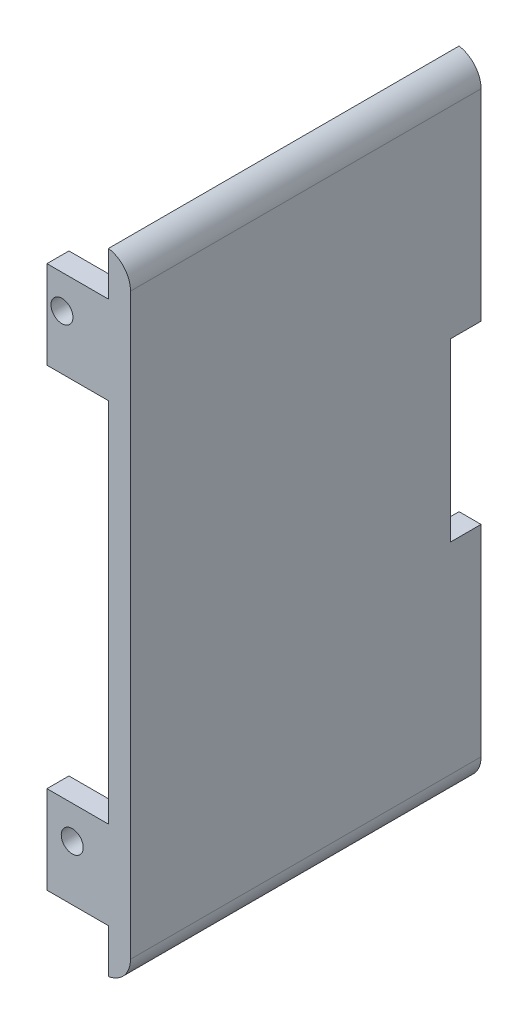
from build123d import *

# Parameters (mm, degrees)
CROQUIS2_W              = 200
CROQUIS2_H              = 150
CROQUIS2_R              = 2
CROQUIS2_R_2            = 2.5
CROQUIS2_W_2            = 31.297292299
CROQUIS2_H_2            = 43.768728426
CROQUIS2_H_3            = 43.768728427
CROQUIS2_W_3            = 23.573907934
CROQUIS2_H_4            = 45.323962431
SALIENTE_EXTRUIR1_DEPTH = 2
REDONDEO1_R             = 10
BOSS_EXTRUDE1_DEPTH     = 25
SKETCH3_W               = 62.040442094
SKETCH3_H               = 5.530821024
BOSS_EXTRUDE2_DEPTH     = 22
SKETCH8_W               = 62.040442094
SKETCH8_H               = 5.530821024
BOSS_EXTRUDE6_DEPTH     = 13
SKETCH2_W               = 200
SKETCH2_H               = 78.124132015
SKETCH2_W_2             = 62.040442094
SKETCH2_H_2             = 5.530821024
BOSS_EXTRUDE3_DEPTH     = 5
SKETCH4_W               = 62.040442094
SKETCH4_H               = 5.530821024
BOSS_EXTRUDE4_DEPTH     = 19
SKETCH5_W               = 7.442573222
SKETCH5_H               = 2.991451355
BOSS_EXTRUDE5_DEPTH     = 21
SKETCH6_R               = 2.5
CUT_EXTRUDE1_DEPTH      = 158.961544101
FILLET1_R               = 10
SKETCH10_W              = 79.68896036
SKETCH10_H              = 143.358595358
BOSS_EXTRUDE7_DEPTH     = 5
SKETCH11_W              = 5
SKETCH11_H              = 20
BOSS_EXTRUDE13_DEPTH    = 14
SKETCH12_R              = 2.5
CUT_EXTRUDE2_DEPTH      = 176.118897221
FILLET2_R               = 6
CUT_EXTRUDE3_DEPTH      = 222.270727407
SKETCH14_W              = 12
SKETCH14_H              = 2
CUT_EXTRUDE4_DEPTH      = 198.082327879
SKETCH15_W              = 7
SKETCH15_H              = 40
CUT_EXTRUDE5_DEPTH      = 10


with BuildPart() as part:
    # Croquis2 → Saliente-Extruir1 (new body)
    with BuildSketch(Plane.XY):
        with Locations((0.108263467, -0.36008145)):
            Rectangle(CROQUIS2_W, CROQUIS2_H)
        with Locations((89.108263467, -66.5)):
            Circle(CROQUIS2_R, mode=Mode.SUBTRACT)
        with Locations((-88.891736533, -66.5)):
            Circle(CROQUIS2_R, mode=Mode.SUBTRACT)
        with Locations(Location((89.108263467, 65.779837101, 0), (0, 0, 180))):
            Circle(CROQUIS2_R, mode=Mode.SUBTRACT)
        with Locations(Location((-88.891736533, 65.779837101, 0), (0, 0, 180))):
            Circle(CROQUIS2_R, mode=Mode.SUBTRACT)
        with Locations((-80.865436179, -59.36008145)):
            Circle(CROQUIS2_R_2, mode=Mode.SUBTRACT)
        with Locations((81.108263467, -59.36008145)):
            Circle(CROQUIS2_R_2, mode=Mode.SUBTRACT)
        with Locations(Location((81.108263467, 58.63991855, 0), (0, 0, 180))):
            Circle(CROQUIS2_R_2, mode=Mode.SUBTRACT)
        with Locations(Location((-80.865436179, 58.63991855, 0), (0, 0, 180))):
            Circle(CROQUIS2_R_2, mode=Mode.SUBTRACT)
        with BuildLine():
            Line((-62.091736533, 70.63991855), (64.108263467, 70.63991855))
            ThreePointArc((64.108263467, 70.63991855), (66.108263467, 68.63991855), (64.108263467, 66.63991855))
            Line((64.108263467, 66.63991855), (-62.091736533, 66.63991855))
            ThreePointArc((-62.091736533, 66.63991855), (-64.091736533, 68.63991855), (-62.091736533, 70.63991855))
        make_face(mode=Mode.SUBTRACT)
        Polygon((-71.391736533, -12.902447307), (-71.391736533, 12.182284408), (-79.241736533, 12.28991855), (-83.891736533, 12.28991855), (-83.891736533, -13.01008145), (-79.241736533, -13.01008145), align=None, mode=Mode.SUBTRACT)
        with BuildLine():
            Line((92.108263467, 45.478381757), (92.108263467, -46.198544657))
            ThreePointArc((92.108263467, -46.198544657), (90.807295546, -47.897576736), (89.108263467, -46.596608814))
            Line((89.108263467, -46.596608814), (89.108263467, 45.876445915))
            ThreePointArc((89.108263467, 45.876445915), (90.807295546, 47.177413836), (92.108263467, 45.478381757))
        make_face(mode=Mode.SUBTRACT)
        Polygon((84.108263467, 12.28991855), (84.108263467, -13.01008145), (79.458263467, -13.01008145), (71.608263467, -13.01008145), (71.608263467, 12.28991855), (79.458263467, 12.28991855), align=None, mode=Mode.SUBTRACT)
        with BuildLine():
            Line((-91.891736533, 45.478381757), (-91.891736533, -46.198544657))
            ThreePointArc((-91.891736533, -46.198544657), (-90.590768612, -47.897576736), (-88.891736533, -46.596608814))
            Line((-88.891736533, -46.596608814), (-88.891736533, 45.876445915))
            ThreePointArc((-88.891736533, 45.876445915), (-90.590768612, 47.177413836), (-91.891736533, 45.478381757))
        make_face(mode=Mode.SUBTRACT)
        with Locations((-30.011405388, 36.299005811)):
            Rectangle(CROQUIS2_W_2, CROQUIS2_H_2, mode=Mode.SUBTRACT)
        with BuildLine():
            Line((-62.091736533, -71.36008145), (64.108263467, -71.36008145))
            ThreePointArc((64.108263467, -71.36008145), (66.108263467, -69.36008145), (64.108263467, -67.36008145))
            Line((64.108263467, -67.36008145), (-62.091736533, -67.36008145))
            ThreePointArc((-62.091736533, -67.36008145), (-64.091736533, -69.36008145), (-62.091736533, -71.36008145))
        make_face(mode=Mode.SUBTRACT)
        with Locations((-30.011405388, -26.799059535)):
            Rectangle(CROQUIS2_W_2, CROQUIS2_H_3, mode=Mode.SUBTRACT)
        with Locations((12.982877294, -0.693345879)):
            Rectangle(CROQUIS2_W_3, CROQUIS2_H_4, mode=Mode.SUBTRACT)
    extrude(amount=SALIENTE_EXTRUIR1_DEPTH)

    # Redondeo1
    redondeo1_edges = [part.edges().sort_by_distance(p)[0] for p in [
        (100.108263467, -75.36008145, 1),
        (-99.891736533, -75.36008145, 1),
        (-99.891736533, 74.63991855, 1),
        (100.108263467, 74.63991855, 1),
    ]]
    fillet(redondeo1_edges, radius=REDONDEO1_R)

    # Sketch1 → Boss-Extrude1 (add)
    with BuildSketch(Plane.XY.offset(2)):
        Polygon((-67.071845217, 64.63991855), (-67.071845217, 60.63991855), (-8.841198185, 60.63991855), (-8.841198185, 3.63991855), (-67.071845217, 3.63991855), (-67.071845217, -0.36008145), (-8.841198185, -0.36008145), (-8.841198185, -53.36008145), (-67.071845217, -53.36008145), (-67.071845217, -57.574734434), (-5.031403123, -57.574734434), (-5.031403123, -40.931443482), (46.608263467, -40.931443482), (46.608263467, -36.931443482), (-5.031403123, -36.931443482), (-5.031403123, 30.068556518), (46.608263467, 30.068556518), (46.608263467, 34.068556518), (-5.031403123, 34.068556518), (-5.031403123, 64.63991855), align=None)
    extrude(amount=BOSS_EXTRUDE1_DEPTH)

    # Sketch3 → Boss-Extrude2 (add)
    with BuildSketch(Plane.XZ.offset(57.574734434)):
        with Locations((-36.05162417, 24.234589488)):
            Rectangle(SKETCH3_W, SKETCH3_H)
    extrude(amount=BOSS_EXTRUDE2_DEPTH)

    # Sketch8 → Boss-Extrude6 (add)
    with BuildSketch(Plane(origin=(0, 64.63991855, 0), x_dir=(1, 0, 0), z_dir=(0, 1, 0))):
        with Locations((-36.05162417, -24.234589488)):
            Rectangle(SKETCH8_W, SKETCH8_H)
    extrude(amount=BOSS_EXTRUDE6_DEPTH)

    # Sketch2 → Boss-Extrude3 (add)
    with BuildSketch(Plane.XZ.offset(75.36008145)):
        with Locations((0.108263467, 41.062066008)):
            Rectangle(SKETCH2_W, SKETCH2_H)
        with Locations((-36.05162417, 24.234589488)):
            Rectangle(SKETCH2_W_2, SKETCH2_H_2, mode=Mode.SUBTRACT)
    extrude(amount=-BOSS_EXTRUDE3_DEPTH)

    # Sketch4 → Boss-Extrude4 (add)
    with BuildSketch(Plane(origin=(0, 64.63991855, 0), x_dir=(1, 0, 0), z_dir=(0, 1, 0))):
        with Locations((-36.05162417, -24.234589488)):
            Rectangle(SKETCH4_W, SKETCH4_H)
    extrude(amount=BOSS_EXTRUDE4_DEPTH)

    # Sketch5 → Boss-Extrude5 (add)
    with BuildSketch(Plane.XZ.offset(75.36008145)):
        with Locations((-80.540187187, 3.495725678)):
            Rectangle(SKETCH5_W, SKETCH5_H)
        with Locations((80.756714122, 3.495725678)):
            Rectangle(SKETCH5_W, SKETCH5_H)
    extrude(amount=BOSS_EXTRUDE5_DEPTH)

    # Sketch6 → Cut-Extrude1 (cut, through all)
    with BuildSketch(Plane.XY.offset(4.991451355)):
        with Locations((-80.996023003, -59.284349751)):
            Circle(SKETCH6_R)
        with Locations((81.166025964, -59.051385225)):
            Circle(SKETCH6_R)
    extrude(amount=-CUT_EXTRUDE1_DEPTH, mode=Mode.SUBTRACT)

    # Fillet1
    # the kernel refuses this fillet: 10 mm, written as the material it takes off along each edge
    with BuildSketch(Plane(origin=(100.108263467, -70.36008145, 2), x_dir=(-1, 0, 0), z_dir=(0, 0, 1)), Plane(origin=(-99.891736533, -70.36008145, 101.77476711), x_dir=(1, 0, 0), z_dir=(0, 0, -1))) as fillet1_piece_1:
        with BuildLine():
            CenterArc((8.660254038, 10), FILLET1_R, 210, 60)
            Line((0, 5), (0, 0))
            Line((0, 0), (8.660254038, 0))
        make_face()
    extrude(amount=99.77476711, mode=Mode.SUBTRACT)


with BuildPart() as body_2:
    # Sketch10 → Boss-Extrude7 (new body)
    with BuildSketch(Plane.ZY.offset(99.891736533)):
        with Locations((-39.84448018, -0.278985798)):
            Rectangle(SKETCH10_W, SKETCH10_H)
    extrude(amount=BOSS_EXTRUDE7_DEPTH)

    # Sketch11 → Boss-Extrude13 (add)
    with BuildSketch(Plane.ZY.offset(104.891736533)):
        with Locations((-2.5, -51.958283477)):
            Rectangle(SKETCH11_W, SKETCH11_H)
        with Locations((-2.5, 51.400311881)):
            Rectangle(SKETCH11_W, SKETCH11_H)
    extrude(amount=BOSS_EXTRUDE13_DEPTH)


with BuildPart() as cut_extrude2_tool:
    # Sketch12 → Cut-Extrude2 (new, through all)
    with BuildSketch(Plane(origin=(0, 0, -5), x_dir=(-1, 0, 0), z_dir=(0, 0, -1))):
        with Locations((94.306850379, -54.336044589)):
            Circle(SKETCH12_R)
        with Locations((94.306850379, 53.778072993)):
            Circle(SKETCH12_R)
        with Locations((115.476622686, 53.778072993)):
            Circle(SKETCH12_R)
        with Locations((113.140977594, -49.445291065)):
            Circle(SKETCH12_R)
    extrude(amount=-CUT_EXTRUDE2_DEPTH)


with BuildPart() as part_1:
    add(part.part)

    # Cut-Extrude2: cut by cut_extrude2_tool
    add(cut_extrude2_tool.part, mode=Mode.SUBTRACT)

    # Sketch13 → Cut-Extrude3 (cut, through all)
    with BuildSketch(Plane.XY.offset(80.124132015)):
        Polygon((-88.891736533, 41.400311881), (-87.891736533, 41.400311881), (-87.891736533, 63.52554782), (-99.891736533, 63.52554782), (-99.891736533, 94.010082764), (108.48763668, 94.010082764), (108.48763668, -102.123784964), (-99.891736533, -102.123784964), (-99.891736533, -61.922986139), (-88.478309969, -61.922986139), (-88.478309969, -40.956005085), (-99.891736533, -40.956005085), (-99.891736533, 41.400311881), align=None)
    extrude(amount=-CUT_EXTRUDE3_DEPTH, mode=Mode.SUBTRACT)


with BuildPart() as body_2_1:
    add(body_2.part)

    # Cut-Extrude2: cut by cut_extrude2_tool
    add(cut_extrude2_tool.part, mode=Mode.SUBTRACT)

    # Fillet2
    # the kernel refuses this fillet: 6 mm, written as the material it takes off along each edge
    with BuildSketch(Plane(origin=(-99.891736533, -71.958283477, -94.479159818), x_dir=(0, 1, 0), z_dir=(0, 0, 1))) as fillet2_piece_1:
        with BuildLine():
            CenterArc((5.916079783, 6), FILLET2_R, 189.594068227, 80.405931773)
            Line((0, 5), (-0.118321596, 4.98))
            ThreePointArc((-0.118321596, 4.98), (-0.12, 2.5), (-0.12, 0))
            Line((-0.12, 0), (0, -0.12))
            Line((0, -0.12), (5.916079783, -0.12))
            Line((5.916079783, -0.12), (5.916079783, 0))
        make_face()
    extrude(amount=109.269359275, mode=Mode.SUBTRACT)
    with BuildSketch(Plane(origin=(-99.891736533, 71.400311881, 14.790199458), x_dir=(-1, 0, 0), z_dir=(0, 0, -1))) as fillet2_piece_2:
        with BuildLine():
            CenterArc((6, -5.916079783), FILLET2_R, 99.594068227, 80.405931773)
            Line((0, -5.916079783), (-0.12, -5.916079783))
            Line((-0.12, -5.916079783), (-0.12, 0))
            Line((-0.12, 0), (0, 0.12))
            ThreePointArc((0, 0.12), (2.5, 0.12), (4.98, 0.118321596))
            Line((4.98, 0.118321596), (5, 0))
        make_face()
    extrude(amount=109.269359275, mode=Mode.SUBTRACT)

    # Sketch15 → Cut-Extrude5 (cut)
    with BuildSketch(Plane.ZY.offset(104.891736533)):
        with Locations((-76.18896036, -0.278985798)):
            Rectangle(SKETCH15_W, SKETCH15_H)
    extrude(amount=-CUT_EXTRUDE5_DEPTH, mode=Mode.SUBTRACT)


with BuildPart() as cut_extrude3_piece_1:
    # of the separate pieces the step leaves, piece 1, a body of its own (cut_extrude3_pieces)
    add(part_1.part.solids().sort_by_distance((-99.891736533, 63.52554782, 0))[0])


with BuildPart() as cut_extrude3_piece_2:
    # of the separate pieces the step leaves, piece 2, a body of its own (cut_extrude3_pieces)
    add(part_1.part.solids().sort_by_distance((-99.891736533, -40.956005085, 0))[0])


with BuildPart() as cut_extrude4_tool:
    # Sketch14 → Cut-Extrude4 (new, through all)
    with BuildSketch(Plane(origin=(0, 63.52554782, 0), x_dir=(1, 0, 0), z_dir=(0, 1, 0))):
        with Locations((-93.891736533, -1)):
            Rectangle(SKETCH14_W, SKETCH14_H)
    extrude(amount=-CUT_EXTRUDE4_DEPTH)


with BuildPart() as cut_extrude3_piece_1_1:
    add(cut_extrude3_piece_1.part)

    # Cut-Extrude4: cut by cut_extrude4_tool
    add(cut_extrude4_tool.part, mode=Mode.SUBTRACT)


with BuildPart() as cut_extrude3_piece_2_1:
    add(cut_extrude3_piece_2.part)

    # Cut-Extrude4: cut by cut_extrude4_tool
    add(cut_extrude4_tool.part, mode=Mode.SUBTRACT)


solid = body_2_1.part
